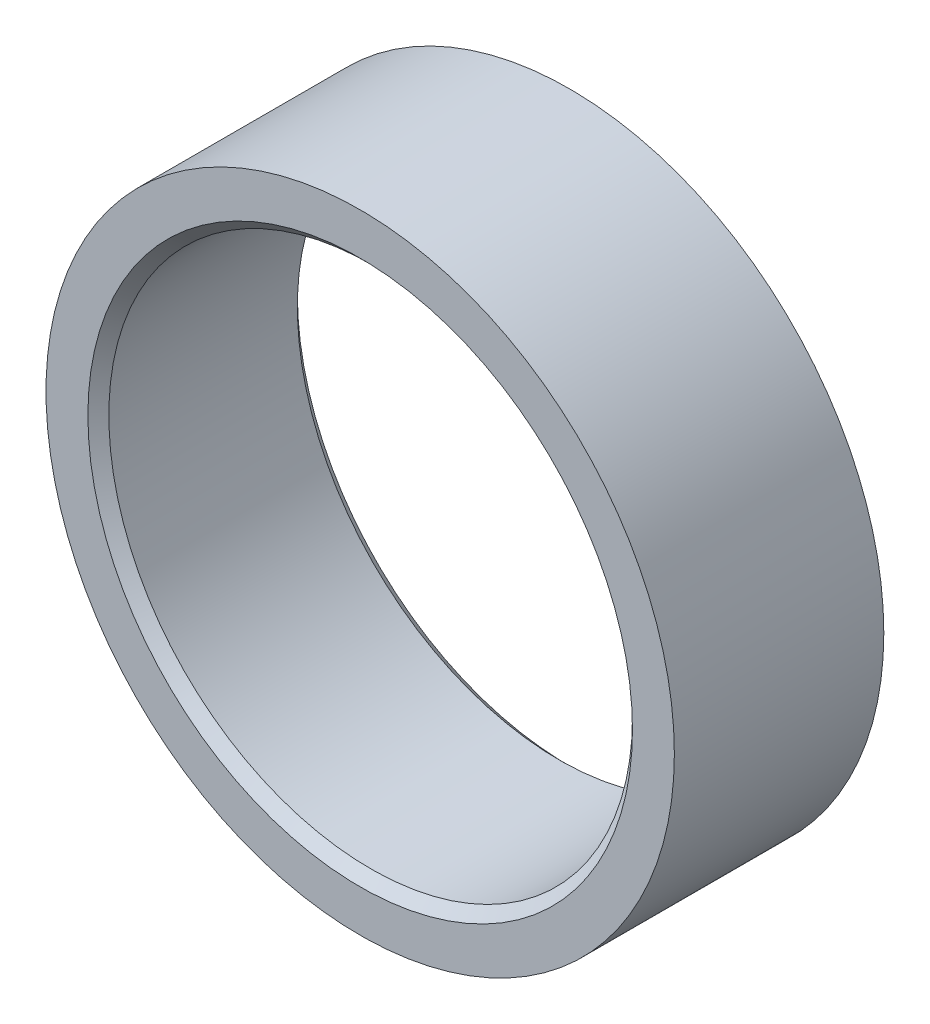
from build123d import *

# Parameters (mm, degrees)
SKETCH_1_R      = 6
SKETCH_1_R_2    = 5
EXTRUDE_1_DEPTH = 4
CHAMFER_1_SIZE  = 0.2


with BuildPart() as part:
    # 草图1 → 凸台-拉伸1 (new body)
    with BuildSketch(Plane.XY):
        Circle(SKETCH_1_R)
        Circle(SKETCH_1_R_2, mode=Mode.SUBTRACT)
    extrude(amount=EXTRUDE_1_DEPTH)

    # 倒角1
    chamfer_1_edges = [part.edges().sort_by_distance(p)[0] for p in [
        (-5, 0, 0),
        (-5, 0, 4),
    ]]
    chamfer(chamfer_1_edges, length=CHAMFER_1_SIZE)


solid = part.part
